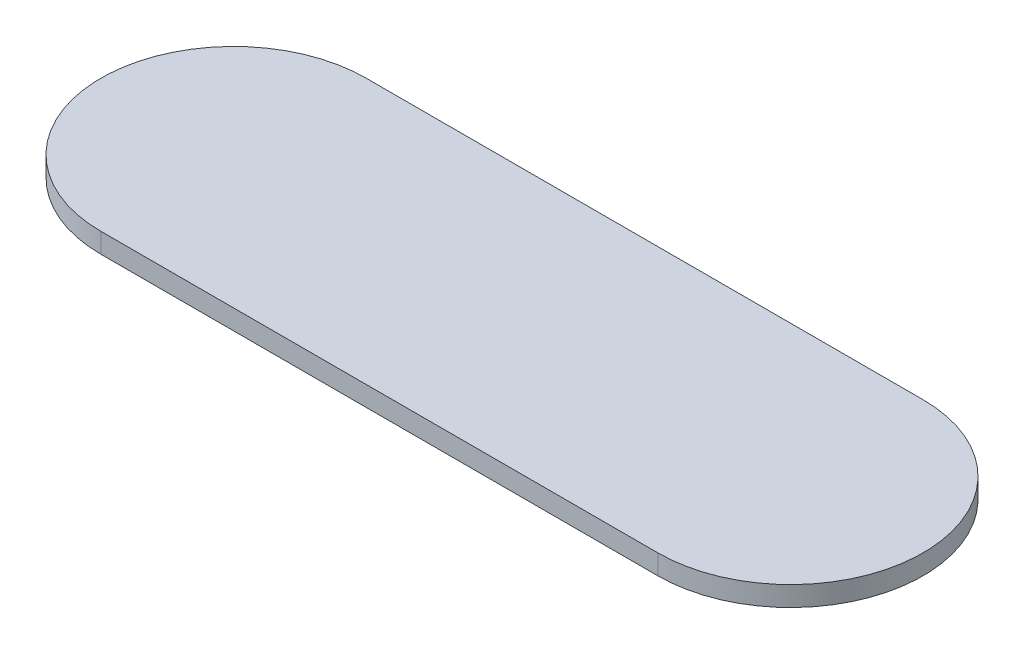
from build123d import *

# Parameters (mm, degrees)
BOSS_EXTRUDE1_DEPTH = 3


with BuildPart() as part:
    # Sketch2 → Boss-Extrude1 (new body)
    with BuildSketch(Plane(origin=(0, 0, 0), x_dir=(1, 0, 0), z_dir=(0, 1, 0))):
        with BuildLine():
            Line((42, 20), (-42, 20))
            ThreePointArc((-42, 20), (-62, 0), (-42, -20))
            Line((-42, -20), (42, -20))
            ThreePointArc((42, -20), (62, 0), (42, 20))
        make_face()
    extrude(amount=BOSS_EXTRUDE1_DEPTH)


solid = part.part
